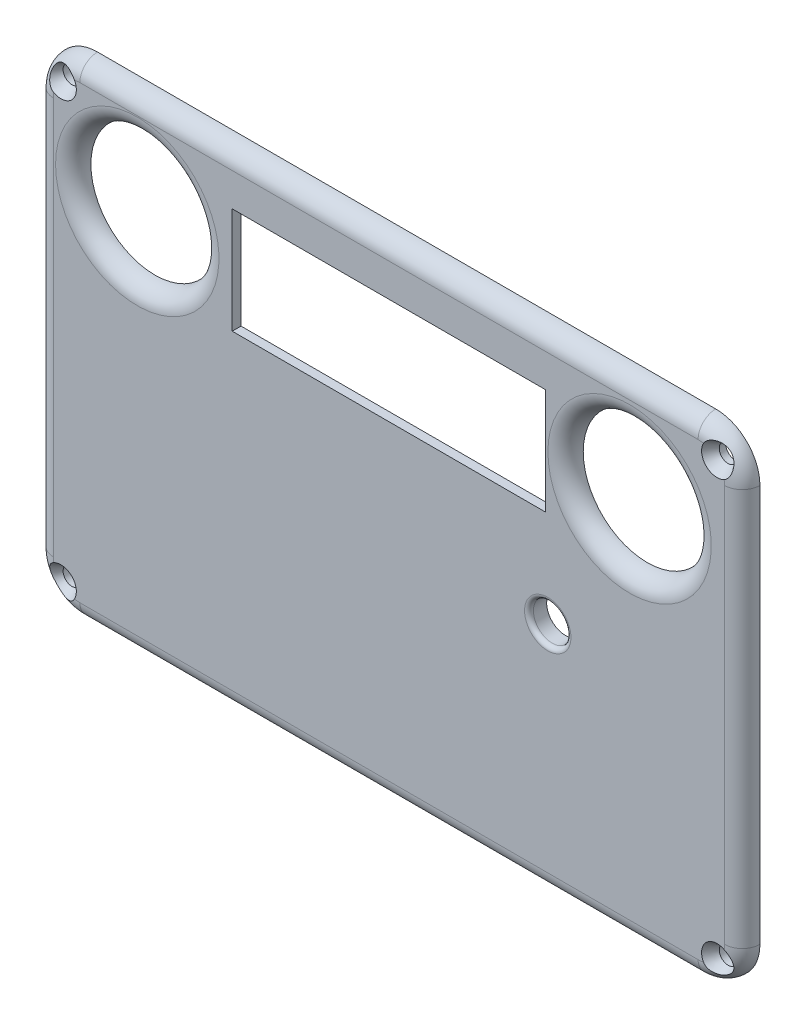
from build123d import *

# Parameters (mm, degrees)
IZIM1_W                     = 160
IZIM1_H                     = 110
IZIM1_R                     = 14.5
IZIM1_R_2                   = 4.25
IZIM1_R_3                   = 2
IZIM1_R_4                   = 2.000514333
IZIM1_W_2                   = 71
IZIM1_H_2                   = 24
Y_KSEKLIK_EKSTR_ZYON1_DEPTH = 4
RADYUS1_R                   = 10
RADYUS2_R                   = 4
IZIM2_W                     = 76.3
IZIM2_H                     = 32.8
KES_EKSTR_ZYON1_DEPTH       = 2
RADYUS3_R                   = 4
RADYUS4_R                   = 1


with BuildPart() as part:
    # Çizim1 → Yükseklik-Ekstrüzyon1 (new body)
    with BuildSketch(Plane.XY):
        Rectangle(IZIM1_W, IZIM1_H)
        with Locations((-57, 32.25)):
            Circle(IZIM1_R, mode=Mode.SUBTRACT)
        with Locations((54.491616853, 31.612)):
            Circle(IZIM1_R, mode=Mode.SUBTRACT)
        with Locations((35.958383147, -2.2)):
            Circle(IZIM1_R_2, mode=Mode.SUBTRACT)
        with Locations((-74.291978978, -49.192721843)):
            Circle(IZIM1_R_3, mode=Mode.SUBTRACT)
        with Locations((-74.291616853, 49.193092508)):
            Circle(IZIM1_R_4, mode=Mode.SUBTRACT)
        with Locations((74.291978978, 49.192721843)):
            Circle(IZIM1_R_3, mode=Mode.SUBTRACT)
        with Locations((74.291978978, -49.192721843)):
            Circle(IZIM1_R_3, mode=Mode.SUBTRACT)
        with Locations((0, 31.5)):
            Rectangle(IZIM1_W_2, IZIM1_H_2, mode=Mode.SUBTRACT)
    extrude(amount=Y_KSEKLIK_EKSTR_ZYON1_DEPTH)

    # Radyus1
    radyus1_edges = [part.edges().sort_by_distance(p)[0] for p in [
        (80, -55, 2),
        (-80, -55, 2),
        (-80, 55, 2),
        (80, 55, 2),
    ]]
    fillet(radyus1_edges, radius=RADYUS1_R)

    # Radyus2
    radyus2_edges = [part.edges().sort_by_distance(p)[0] for p in [
        (-71.5, 32.25, 4),
        (39.991616853, 31.612, 4),
    ]]
    fillet(radyus2_edges, radius=RADYUS2_R - 0.0001)  # a hair under: the kernel refuses the full size

    # Çizim2 → Kes-Ekstrüzyon1 (cut)
    with BuildSketch(Plane(origin=(0, 0, 0), x_dir=(-1, 0, 0), z_dir=(0, 0, -1))):
        with Locations((0, 32.9)):
            Rectangle(IZIM2_W, IZIM2_H)
    extrude(amount=-KES_EKSTR_ZYON1_DEPTH, mode=Mode.SUBTRACT)

    # Radyus3
    # the kernel refuses this fillet: 4 mm, written as the material it takes off along each edge
    with BuildSketch(Plane(origin=(-70, 45, 4), x_dir=(0, 1, 0), z_dir=(1, 0, 0))) as radyus3_piece_1:
        with BuildLine():
            CenterArc((10 - RADYUS3_R, -RADYUS3_R), RADYUS3_R, 0, 90)
            Line((10, -RADYUS3_R), (10, 0))
            Line((10, 0), (10 - RADYUS3_R, 0))
        make_face()
    revolve(axis=Axis((-70, 45, 4), (0, 0, 1)), revolution_arc=90, mode=Mode.SUBTRACT)
    with BuildSketch(Plane(origin=(70, 55, 4), x_dir=(0, -1, 0), z_dir=(-1, 0, 0)), Plane(origin=(-70, -55, 4), x_dir=(0, 1, 0), z_dir=(1, 0, 0))) as radyus3_piece_2:
        with BuildLine():
            CenterArc((RADYUS3_R, -RADYUS3_R), RADYUS3_R, 90, 90)
            Line((0, -RADYUS3_R), (0, 0))
            Line((0, 0), (RADYUS3_R, 0))
        make_face()
    extrude(amount=140, mode=Mode.SUBTRACT)
    with BuildSketch(Plane(origin=(70, 45, 4), x_dir=(1, 0, 0), z_dir=(0, -1, 0))) as radyus3_piece_3:
        with BuildLine():
            CenterArc((10 - RADYUS3_R, -RADYUS3_R), RADYUS3_R, 0, 90)
            Line((10, -RADYUS3_R), (10, 0))
            Line((10, 0), (10 - RADYUS3_R, 0))
        make_face()
    revolve(axis=Axis((70, 45, 4), (0, 0, 1)), revolution_arc=90, mode=Mode.SUBTRACT)
    with BuildSketch(Plane(origin=(80, -45, 4), x_dir=(-1, 0, 0), z_dir=(0, 1, 0)), Plane(origin=(-80, 45, 4), x_dir=(1, 0, 0), z_dir=(0, -1, 0))) as radyus3_piece_4:
        with BuildLine():
            CenterArc((RADYUS3_R, -RADYUS3_R), RADYUS3_R, 90, 90)
            Line((0, -RADYUS3_R), (0, 0))
            Line((0, 0), (RADYUS3_R, 0))
        make_face()
    extrude(amount=90, mode=Mode.SUBTRACT)
    with BuildSketch(Plane(origin=(70, -45, 4), x_dir=(0, -1, 0), z_dir=(-1, 0, 0))) as radyus3_piece_5:
        with BuildLine():
            CenterArc((10 - RADYUS3_R, -RADYUS3_R), RADYUS3_R, 0, 90)
            Line((10, -RADYUS3_R), (10, 0))
            Line((10, 0), (10 - RADYUS3_R, 0))
        make_face()
    revolve(axis=Axis((70, -45, 4), (0, 0, 1)), revolution_arc=90, mode=Mode.SUBTRACT)
    with BuildSketch(Plane(origin=(-70, -45, 4), x_dir=(0, -1, 0), z_dir=(1, 0, 0))) as radyus3_piece_6:
        with BuildLine():
            CenterArc((10 - RADYUS3_R, RADYUS3_R), RADYUS3_R, 270, 90)
            Line((10, RADYUS3_R), (10, 0))
            Line((10, 0), (10 - RADYUS3_R, 0))
        make_face()
    revolve(axis=Axis((-70, -45, 4), (0, 0, -1)), revolution_arc=90, mode=Mode.SUBTRACT)

    # Kes-Loft1: read off the stored shape, not the designer's step
    # Kes-Loft1: loft between two sections, ruled curve by curve
    kes_loft1_from = [
        Edge.make_bspline([(-74.682775848, -51.154169728, 1.5), (-70.759880078, -51.935763469, 1.5), (-69.978286337, -48.012867699, 1.5), (-73.901182107, -47.231273958, 1.5), (-77.824077878, -46.449680217, 1.5), (-78.605671618, -50.372575988, 1.5), (-74.682775848, -51.154169728, 1.5)], [0, 0, 0, 0, 0.5, 0.5, 0.5, 1, 1, 1, 1], 3, [1, 0.333333333, 0.333333333, 1, 0.333333333, 0.333333333, 1]),
    ]
    kes_loft1_to = [
        Edge.make_bspline([(-75.734283229, -52.381727715, 4), (-69.356271486, -55.266336217, 4), (-66.471662984, -48.888324474, 4), (-72.849674727, -46.003715972, 4), (-79.227686469, -43.11910747, 4), (-82.112294971, -49.497119212, 4), (-75.734283229, -52.381727715, 4)], [0, 0, 0, 0, 0.5, 0.5, 0.5, 1, 1, 1, 1], 3, [1, 0.333333333, 0.333333333, 1, 0.333333333, 0.333333333, 1]),
    ]
    kes_loft1 = Solid(Shell([*[Face.make_surface_from_curves(kes_loft1_from[k], kes_loft1_to[k]) for k in range(1)], Face(Wire(kes_loft1_from)), Face(Wire(kes_loft1_to))]))
    add(kes_loft1, mode=Mode.SUBTRACT)

    # Aynalama1: read off the stored shape, not the designer's step
    # Aynalama1: loft between two sections, ruled curve by curve
    aynalama1_from = [
        Edge.make_bspline([(74.682775848, -51.154169728, 1.5), (70.759880078, -51.935763469, 1.5), (69.978286337, -48.012867699, 1.5), (73.901182107, -47.231273958, 1.5), (77.824077878, -46.449680217, 1.5), (78.605671618, -50.372575988, 1.5), (74.682775848, -51.154169728, 1.5)], [0, 0, 0, 0, 0.5, 0.5, 0.5, 1, 1, 1, 1], 3, [1, 0.333333333, 0.333333333, 1, 0.333333333, 0.333333333, 1]),
    ]
    aynalama1_to = [
        Edge.make_bspline([(75.734283229, -52.381727715, 4), (69.356271486, -55.266336217, 4), (66.471662984, -48.888324474, 4), (72.849674727, -46.003715972, 4), (79.227686469, -43.11910747, 4), (82.112294971, -49.497119212, 4), (75.734283229, -52.381727715, 4)], [0, 0, 0, 0, 0.5, 0.5, 0.5, 1, 1, 1, 1], 3, [1, 0.333333333, 0.333333333, 1, 0.333333333, 0.333333333, 1]),
    ]
    aynalama1 = Solid(Shell([*[Face.make_surface_from_curves(aynalama1_from[k], aynalama1_to[k]) for k in range(1)], Face(Wire(aynalama1_from)), Face(Wire(aynalama1_to))]))
    add(aynalama1, mode=Mode.SUBTRACT)

    # Aynalama1 2: loft between two sections, ruled curve by curve
    aynalama1_2_from = [
        Edge.make_bspline([(-74.682775848, 51.154169728, 1.5), (-70.759880078, 51.935763469, 1.5), (-69.978286337, 48.012867699, 1.5), (-73.901182107, 47.231273958, 1.5), (-77.824077878, 46.449680217, 1.5), (-78.605671618, 50.372575988, 1.5), (-74.682775848, 51.154169728, 1.5)], [0, 0, 0, 0, 0.5, 0.5, 0.5, 1, 1, 1, 1], 3, [1, 0.333333333, 0.333333333, 1, 0.333333333, 0.333333333, 1]),
    ]
    aynalama1_2_to = [
        Edge.make_bspline([(-75.734283229, 52.381727715, 4), (-69.356271486, 55.266336217, 4), (-66.471662984, 48.888324474, 4), (-72.849674727, 46.003715972, 4), (-79.227686469, 43.11910747, 4), (-82.112294971, 49.497119212, 4), (-75.734283229, 52.381727715, 4)], [0, 0, 0, 0, 0.5, 0.5, 0.5, 1, 1, 1, 1], 3, [1, 0.333333333, 0.333333333, 1, 0.333333333, 0.333333333, 1]),
    ]
    aynalama1_2 = Solid(Shell([*[Face.make_surface_from_curves(aynalama1_2_from[k], aynalama1_2_to[k]) for k in range(1)], Face(Wire(aynalama1_2_from)), Face(Wire(aynalama1_2_to))]))
    add(aynalama1_2, mode=Mode.SUBTRACT)

    # Aynalama1 3: loft between two sections, ruled curve by curve
    aynalama1_3_from = [
        Edge.make_bspline([(74.682775848, 51.154169728, 1.5), (70.759880078, 51.935763469, 1.5), (69.978286337, 48.012867699, 1.5), (73.901182107, 47.231273958, 1.5), (77.824077878, 46.449680217, 1.5), (78.605671618, 50.372575988, 1.5), (74.682775848, 51.154169728, 1.5)], [0, 0, 0, 0, 0.5, 0.5, 0.5, 1, 1, 1, 1], 3, [1, 0.333333333, 0.333333333, 1, 0.333333333, 0.333333333, 1]),
    ]
    aynalama1_3_to = [
        Edge.make_bspline([(75.734283229, 52.381727715, 4), (69.356271486, 55.266336217, 4), (66.471662984, 48.888324474, 4), (72.849674727, 46.003715972, 4), (79.227686469, 43.11910747, 4), (82.112294971, 49.497119212, 4), (75.734283229, 52.381727715, 4)], [0, 0, 0, 0, 0.5, 0.5, 0.5, 1, 1, 1, 1], 3, [1, 0.333333333, 0.333333333, 1, 0.333333333, 0.333333333, 1]),
    ]
    aynalama1_3 = Solid(Shell([*[Face.make_surface_from_curves(aynalama1_3_from[k], aynalama1_3_to[k]) for k in range(1)], Face(Wire(aynalama1_3_from)), Face(Wire(aynalama1_3_to))]))
    add(aynalama1_3, mode=Mode.SUBTRACT)

    # Radyus4
    radyus4_edges = [part.edges().sort_by_distance(p)[0] for p in [
        (31.708383147, -2.2, 4),
    ]]
    fillet(radyus4_edges, radius=RADYUS4_R)


solid = part.part
